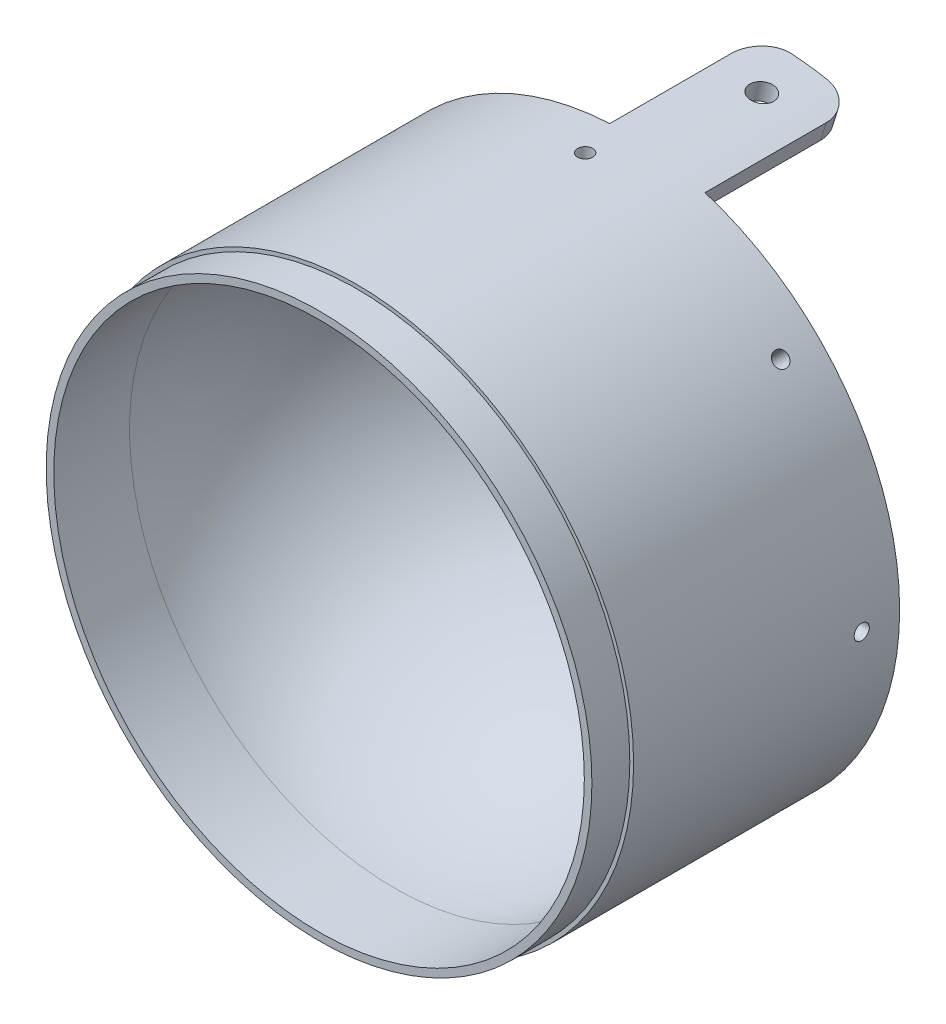
from build123d import *
from build123d.topology import SkipClean

# Parameters (mm, degrees)
CIRPATTERN1_COUNT            = 8
SKETCH55_R                   = 2.175
CUT_EXTRUDE37_DEPTH          = 17.800398408
SCHIZZO1_R                   = 3.175
SCHIZZO1_R_2                 = 2.175
ESTRUSIONE_ESTRUSIONE1_DEPTH = 10
ESTRUSIONE_ESTRUSIONE2_START = 40
ESTRUSIONE_ESTRUSIONE2_DEPTH = 40
RACCORDO1_R                  = 8
SCHIZZO3_R                   = 3.175
TAGLIO_ESTRUSIONE1_DEPTH     = 14


with BuildPart() as part:
    # Sketch18 → Revolve1 (revolve)
    with BuildSketch(Plane(origin=(0, 0, 0), x_dir=(1, 0, 0), z_dir=(0, 1, 0)), mode=Mode.PRIVATE) as revolve1_sk:
        with BuildLine():
            Line((0, 88), (0, 80))
            ThreePointArc((0, 80), (-49.497474683, 59.497474683), (-70, 10))
            Line((-70, 10), (-70, -10))
            Line((-70, -10), (-72, -10))
            Line((-72, -10), (-72, 0))
            Line((-72, 0), (-73, 0))
            Line((-73, 0), (-73, 10))
            Line((-73, 10), (-73, 70.199601592))
            Line((-73, 70.199601592), (-41.29174213, 70.199601592))
            ThreePointArc((-41.29174213, 70.199601592), (-33.410035677, 74.90585117), (-25, 78.585712798))
            Line((-25, 78.585712798), (-25, 88))
            Line((-25, 88), (0, 88))
        make_face()
    revolve(revolve1_sk.sketch.rotate(Axis((0, 0, 0), (0, 0, -1)), 180), axis=Axis((0, 0, 0), (0, 0, -1)))

    # Sketch23 → Ø4.0 (4) Diameter Hole1 (revolve, cut)
    with BuildSketch(Plane(origin=(0, 73, -60.199601592), x_dir=(0, 0, 1), z_dir=(1, 0, 0))):
        Polygon((0, 0), (0, 16.3), (2, 14.3), (2, 0), align=None)
    f_4_0_4_diameter_hole1 = revolve(axis=Axis((0, 79.35, -60.199601592), (0, -1, 0)), mode=Mode.SUBTRACT)

    # CirPattern1: Ø4.0 (4) Diameter Hole1 ×8 about axis
    cirpattern1_axis = Axis((0, 0, 0), (0, 0, -1))
    for i in range(1, CIRPATTERN1_COUNT):
        add(f_4_0_4_diameter_hole1.rotate(cirpattern1_axis, i * 360 / CIRPATTERN1_COUNT), mode=Mode.SUBTRACT)

    # Sketch55 → Cut-Extrude37 (cut)
    with BuildSketch(Plane(origin=(0, 0, -70.199601592), x_dir=(-1, 0, 0), z_dir=(0, 0, -1))):
        with Locations(Location((0, 0, 0), (0, 0, 180))):
            Circle(SKETCH55_R)
    extrude(amount=CUT_EXTRUDE37_DEPTH, mode=Mode.SUBTRACT)

    # Fillet8: read off the stored shape, not the designer's step
    # Fillet8 outline → Fillet8 (revolve, cut)
    with BuildSketch(Plane.XZ):
        with BuildLine():
            ThreePointArc((2.175, -82.816340027), (2.979776356, -80.771592329), (4.962328767, -79.823887698))
            Line((4.962328767, -79.823887698), (2.175, -79.823887698))
            Line((2.175, -79.823887698), (2.175, -82.816340027))
        make_face()
    revolve(axis=Axis((0, 0, 0), (0, 0, 1)), mode=Mode.SUBTRACT)

    # Schizzo1 → Estrusione-Estrusione1 (add)
    with BuildSketch(Plane(origin=(0, 0, -88), x_dir=(-1, 0, 0), z_dir=(0, 0, -1))):
        with Locations(Location((0, 0, 0), (0, 0, 180))):
            Circle(SCHIZZO1_R)
        with Locations(Location((0, 0, 0), (0, 0, 180))):
            Circle(SCHIZZO1_R_2, mode=Mode.SUBTRACT)
    extrude(amount=ESTRUSIONE_ESTRUSIONE1_DEPTH)

    # Schizzo2 → Estrusione-Estrusione2 (add)
    with BuildSketch(Plane(origin=(0, 0, -70.199601592), x_dir=(-1, 0, 0), z_dir=(0, 0, -1)).offset(ESTRUSIONE_ESTRUSIONE2_START)):
        with BuildLine():
            ThreePointArc((3.496742934, 72.916203884), (-2.871629137, 72.943496942), (-9.218146375, 72.415645943))
            Line((-9.218146375, 72.415645943), (-8.586766487, 67.455670194))
            ThreePointArc((-8.586766487, 67.455670194), (-2.674942209, 67.947367014), (3.257239993, 67.921943344))
            Line((3.257239993, 67.921943344), (3.496742934, 72.916203884))
        make_face()
        with BuildLine():
            Line((-8.586766487, 67.455670194), (-9.218146375, 72.415645943))
            ThreePointArc((-9.218146375, 72.415645943), (-15.494507954, 71.336668154), (-21.652946971, 69.714775245))
            Line((-21.652946971, 69.714775245), (-20.169868412, 64.939790639))
            ThreePointArc((-20.169868412, 64.939790639), (-14.433240286, 66.450594992), (-8.586766487, 67.455670194))
        make_face()
    extrude(amount=-ESTRUSIONE_ESTRUSIONE2_DEPTH)

    # Raccordo1
    raccordo1_edges = [part.edges().sort_by_distance(p)[0] for p in [
        (20.911407692, 67.327282942, -110.199601592),
        (-3.376991464, 70.419073614, -110.199601592),
    ]]
    fillet(raccordo1_edges, radius=RACCORDO1_R)

    # Schizzo3 → Taglio-Estrusione1 (cut)
    with SkipClean():  # the faces are left unmerged after this step: merging them gives an invalid solid
        with BuildSketch(Plane(origin=(13.072496691, 62.257996798, 0), x_dir=(0.978658816176937, -0.20549190134688128, 0), z_dir=(0.2054919013468813, 0.9786588161769371, 0))):
            with Locations((-6.110316561, 97.844831396)):
                Circle(SCHIZZO3_R)
        extrude(amount=TAGLIO_ESTRUSIONE1_DEPTH, mode=Mode.SUBTRACT)


solid = part.part
